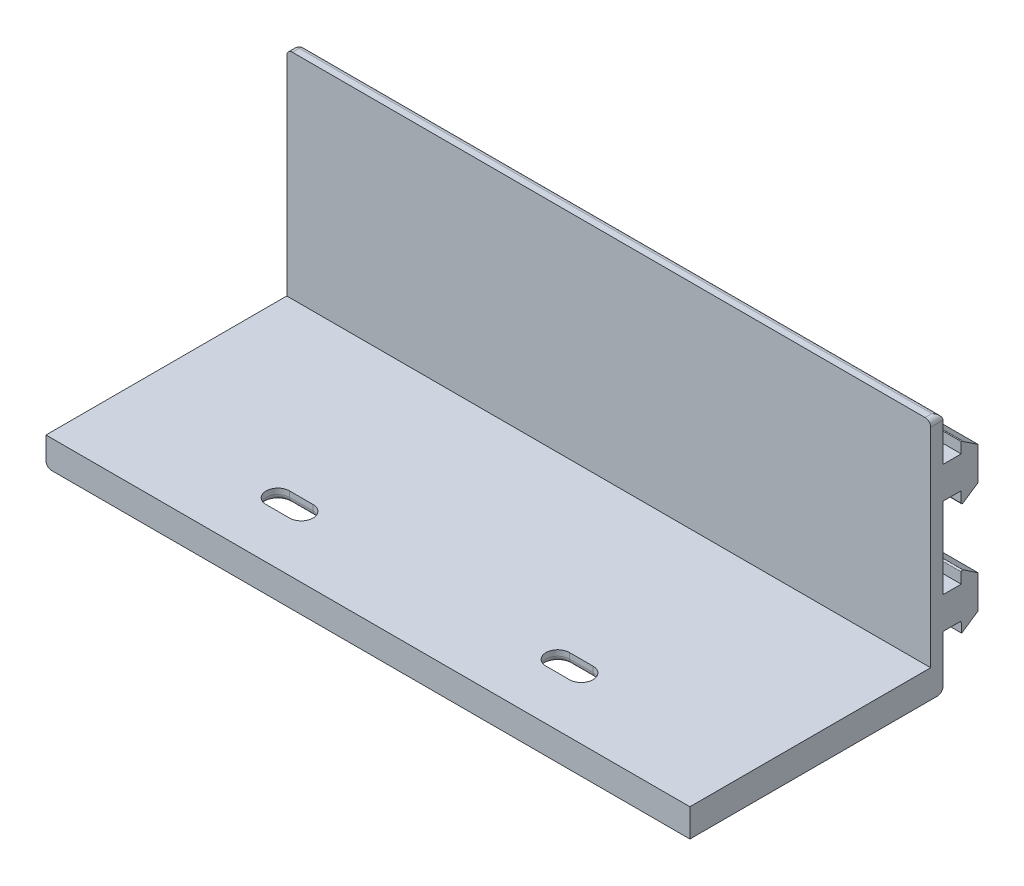
from build123d import *

# Parameters (mm, degrees)
SKETCH_1_W               = 115
SKETCH_1_H               = 30
EXTRUDE_1_DEPTH          = 29
SHELL_1_T                = -2
SKETCH_4_W               = 55
SKETCH_4_H               = 63
EXTRUDE_2_DEPTH          = 2
SKETCH_7_W               = 28
SKETCH_7_H               = 49
CUT_EXTRUDE_2_DEPTH      = 28
EXTRUDE_6_DEPTH          = 29
EXTRUDE_8_DEPTH          = 2
EXTRUDE_9_DEPTH          = 115
FILLET_1_R               = 1
SKETCH_8_R               = 1.2
CUT_EXTRUDE_5_DEPTH      = 10
SKETCH_15_W              = 113
SKETCH_15_H              = 39.979543783
CUT_EXTRUDE_6_DEPTH      = 33
CUT_EXTRUDE_7_REACH      = 152.193
SKETCH_16_W              = 16.4
SKETCH_16_H              = 9.3
SKETCH_17_W              = 40.5
SKETCH_17_H              = 2
EXTRUDE_10_DEPTH         = 113
CUT_EXTRUDE_8_DEPTH      = 147
CUT_EXTRUDE_9_DEPTH      = 147
CUT_EXTRUDE_9_DEPTH_BACK = 147
SKETCH_21_W              = 20.17617045
SKETCH_21_H              = 57.30071962
SKETCH_22_W              = 2
SKETCH_22_H              = 5
CUT_EXTRUDE_11_DEPTH     = 0.2
SKETCH_24_W              = 113
SKETCH_24_H              = 56
EXTRUDE_16_DEPTH         = 0.2
CUT_EXTRUDE_12_DEPTH     = 147
CUT_EXTRUDE_13_DEPTH     = 5
FILLET_8_R               = 1
EXTRUDE_17_DEPTH         = 3
EXTRUDE_17_DEPTH_BACK    = 1
FILLET_10_R              = 1
SKETCH_28_W              = 115
SKETCH_28_H              = 5
EXTRUDE_18_DEPTH         = 1
CUT_EXTRUDE_START        = -3
CUT_EXTRUDE_14_DEPTH     = 3
CHAMFER_7_SIZE           = 3
FILLET_11_R              = 1


with BuildPart() as part:
    # Эскиз1 → Бобышка-Вытянуть1 (new body)
    with BuildSketch(Plane(origin=(0, 0, 0), x_dir=(1, 0, 0), z_dir=(0, 1, 0))):
        with Locations((57.5, 15)):
            Rectangle(SKETCH_1_W, SKETCH_1_H)
    extrude(amount=EXTRUDE_1_DEPTH)

    # Оболочка1
    shell_1_openings = [part.faces().sort_by_distance(p)[0] for p in [
        (57.5, 14.5, 0),
    ]]
    offset(amount=SHELL_1_T, openings=shell_1_openings, kind=Kind.INTERSECTION)

    # Эскиз4 → Бобышка-Вытянуть2 (add)
    with BuildSketch(Plane(origin=(115, 0, 0), x_dir=(0, 0, -1), z_dir=(1, 0, 0))):
        with Locations((15, 31.5)):
            Rectangle(SKETCH_4_W, SKETCH_4_H)
    extrude(amount=EXTRUDE_2_DEPTH)

    # Эскиз7 → Вырез-Вытянуть2 (cut)
    with BuildSketch(Plane(origin=(117, 0, 0), x_dir=(0, 0, -1), z_dir=(1, 0, 0))):
        with Locations((14, 31.5)):
            Rectangle(SKETCH_7_W, SKETCH_7_H)
    extrude(amount=-CUT_EXTRUDE_2_DEPTH, mode=Mode.SUBTRACT)

    # Эскиз10 → Бобышка-Вытянуть6 (add)
    with BuildSketch(Plane(origin=(0, 29, 0), x_dir=(1, 0, 0), z_dir=(0, 1, 0))):
        Polygon((115, 30), (115, 28), (89, 28), (2, 28), (2, 0), (0, 0), (0, 28), (0, 30), (87, 30), align=None)
    extrude(amount=EXTRUDE_6_DEPTH)

    # Эскиз13 → Бобышка-Вытянуть8 (add)
    with BuildSketch(Plane.XZ):
        Polygon((115, 12.5), (115, 40), (0, 40), (0, 0), (115, 0), align=None)
        with BuildLine():
            ThreePointArc((34.6, 31.75), (36.7, 33.85), (34.6, 35.95))
            Line((34.6, 35.95), (30.4, 35.95))
            ThreePointArc((30.4, 35.95), (28.3, 33.85), (30.4, 31.75))
            Line((30.4, 31.75), (34.6, 31.75))
        make_face(mode=Mode.SUBTRACT)
        with BuildLine():
            ThreePointArc((80.4, 35.95), (78.3, 33.85), (80.4, 31.75))
            Line((80.4, 31.75), (84.6, 31.75))
            ThreePointArc((84.6, 31.75), (86.7, 33.85), (84.6, 35.95))
            Line((84.6, 35.95), (80.4, 35.95))
        make_face(mode=Mode.SUBTRACT)
    extrude(amount=-EXTRUDE_8_DEPTH)

    # Эскиз14 → Бобышка-Вытянуть9 (add)
    with BuildSketch(Plane.ZY):
        with BuildLine():
            Line((-33.254799468, 26.65), (-33.254799468, 24.75))
            ThreePointArc((-33.254799468, 24.75), (-33.360427883, 24.57366508), (-33.565739508, 24.583589941))
            Line((-33.565739508, 24.583589941), (-36.254799468, 26.376296582))
            Line((-36.254799468, 26.376296582), (-36.254799468, 32.326296582))
            Line((-36.254799468, 32.326296582), (-33.565739508, 34.119003222))
            ThreePointArc((-33.565739508, 34.119003222), (-33.446213245, 34.269819382), (-33.254799468, 34.25))
            Line((-33.254799468, 34.25), (-33.254799468, 32.35))
            Line((-33.254799468, 32.35), (-30, 32.35))
            Line((-30, 32.35), (-30, 26.65))
            Line((-30, 26.65), (-33.254799468, 26.65))
        make_face()
        with BuildLine():
            Line((-33.254741117, 6.5), (-33.302994959, 4.600612844))
            ThreePointArc((-33.302994959, 4.600612844), (-33.462823881, 4.6084601), (-33.565739508, 4.730996778))
            Line((-33.565739508, 4.730996778), (-36.254799468, 6.523703418))
            Line((-36.254799468, 6.523703418), (-36.254799468, 12.473703418))
            Line((-36.254799468, 12.473703418), (-33.565739508, 14.266410059))
            ThreePointArc((-33.565739508, 14.266410059), (-33.360427883, 14.27633492), (-33.254799468, 14.1))
            Line((-33.254799468, 14.1), (-33.254799468, 12.2))
            Line((-33.254799468, 12.2), (-30, 12.2))
            Line((-30, 12.2), (-30, 6.5))
            Line((-30, 6.5), (-33.254741117, 6.5))
        make_face()
    extrude(amount=-EXTRUDE_9_DEPTH)

    # Скругление1
    fillet_1_edges = [part.edges().sort_by_distance(p)[0] for p in [
        (32.5, 0, 35.95),
        (82.5, 0, 35.95),
        (82.5, 0, 31.75),
        (78.3, 0, 33.85),
        (86.7, 0, 33.85),
        (36.7, 0, 33.85),
        (28.3, 0, 33.85),
        (32.5, 0, 31.75),
    ]]
    fillet(fillet_1_edges, radius=FILLET_1_R)

    # Эскиз8 → Вырез-Вытянуть5 (cut)
    with BuildSketch(Plane(origin=(117, 0, 0), x_dir=(0, 0, -1), z_dir=(1, 0, 0))):
        with Locations((-5.5, 31.5)):
            Circle(SKETCH_8_R)
    extrude(amount=-CUT_EXTRUDE_5_DEPTH, mode=Mode.SUBTRACT)

    # Эскиз15 → Вырез-Вытянуть6 (cut)
    with BuildSketch(Plane.XY.offset(-28)):
        with Locations((58.5, 46.989771892)):
            Rectangle(SKETCH_15_W, SKETCH_15_H)
    extrude(amount=CUT_EXTRUDE_6_DEPTH, mode=Mode.SUBTRACT)

    # Эскиз16 → Вырез-Вытянуть7 (cut, up to next)
    with BuildSketch(Plane(origin=(0, 0, -30), x_dir=(-1, 0, 0), z_dir=(0, 0, -1)), mode=Mode.PRIVATE) as cut_extrude_7_sk1:
        with Locations((-53.2, 49.65)):
            Rectangle(SKETCH_16_W, SKETCH_16_H)
    cut_extrude_7_tool1 = extrude(cut_extrude_7_sk1.sketch, amount=-CUT_EXTRUDE_7_REACH, mode=Mode.PRIVATE) & part.part
    add(cut_extrude_7_tool1.solids().sort_by_distance((53.2, 49.65, -30))[0], mode=Mode.SUBTRACT)

    # Эскиз17 → Бобышка-Вытянуть10 (add)
    with BuildSketch(Plane.ZY.offset(-115)):
        with Locations((-7.75, 57)):
            Rectangle(SKETCH_17_W, SKETCH_17_H)
    extrude(amount=EXTRUDE_10_DEPTH)

    # Эскиз20 → Вырез-Вытянуть8 (cut)
    with BuildSketch(Plane.ZY):
        Polygon((0, 2), (-27.8, 2), (-27.8, 71.965307459), (29.159484087, 71.965307459), (29.159484087, 2), align=None)
    extrude(amount=-CUT_EXTRUDE_8_DEPTH, mode=Mode.SUBTRACT)

    # Эскиз21 → Вырез-Вытянуть9 (cut, two sides: drawn at the far end of the back side and taken through both)
    with BuildSketch(Plane(origin=(0, 2, 0), x_dir=(1, 0, 0), z_dir=(0, 1, 0)).offset(-CUT_EXTRUDE_9_DEPTH_BACK)):
        with Locations((125.088085225, 16.15035981)):
            Rectangle(SKETCH_21_W, SKETCH_21_H)
    extrude(amount=CUT_EXTRUDE_9_DEPTH + CUT_EXTRUDE_9_DEPTH_BACK, mode=Mode.SUBTRACT)

    # Эскиз22 → Вырез-Вытянуть11 (cut)
    with BuildSketch(Plane.XY.offset(-28)):
        with Locations((114, 4.5)):
            Rectangle(SKETCH_22_W, SKETCH_22_H)
    extrude(amount=CUT_EXTRUDE_11_DEPTH, mode=Mode.SUBTRACT)

    # Эскиз24 → Бобышка-Вытянуть16 (add)
    with BuildSketch(Plane.XY.offset(-27.8)):
        with Locations((58.5, 28)):
            Rectangle(SKETCH_24_W, SKETCH_24_H)
    extrude(amount=-EXTRUDE_16_DEPTH)

    # Эскиз25 → Вырез-Вытянуть12 (cut)
    with BuildSketch(Plane(origin=(115, 0, 0), x_dir=(0, 0, -1), z_dir=(1, 0, 0))):
        Polygon((-61.35646419, 61.721146041), (45.258808631, 61.721146041), (45.258808631, 40.2), (-10.2, 40.2), (-10.2, -7.989940419), (-61.35646419, -7.989940419), (-61.35646419, 40.2), align=None)
    extrude(amount=-CUT_EXTRUDE_12_DEPTH, mode=Mode.SUBTRACT)

    # Эскиз26 → Вырез-Вытянуть13 (cut)
    with BuildSketch(Plane(origin=(0, 2, 0), x_dir=(1, 0, 0), z_dir=(0, 1, 0))):
        with BuildLine():
            Line((30.4, -2.1), (34.6, -2.1))
            ThreePointArc((34.6, -2.1), (36.7, -4.2), (34.6, -6.3))
            Line((34.6, -6.3), (30.4, -6.3))
            ThreePointArc((30.4, -6.3), (28.3, -4.2), (30.4, -2.1))
        make_face()
        with BuildLine():
            Line((80.4, -2.1), (84.6, -2.1))
            ThreePointArc((84.6, -2.1), (86.7, -4.2), (84.6, -6.3))
            Line((84.6, -6.3), (80.4, -6.3))
            ThreePointArc((80.4, -6.3), (78.3, -4.2), (80.4, -2.1))
        make_face()
    extrude(amount=-CUT_EXTRUDE_13_DEPTH, mode=Mode.SUBTRACT)

    # Скругление8
    fillet_8_edges = [part.edges().sort_by_distance(p)[0] for p in [
        (0, 3.25, -30),
        (0, 19.425, -30),
        (0, 36.275, -30),
        (0, 40.2, -28.9),
        (57.5, 40.2, -30),
        (115, 40.2, -28.9),
        (57.5, 0, 10.2),
        (57.5, 0, -30),
        (0, 0, -9.9),
    ]]
    fillet(fillet_8_edges, radius=FILLET_8_R)

    # Эскиз27 → Бобышка-Вытянуть17 (add, two sides: drawn at the far end of the back side and taken through both)
    with BuildSketch(Plane.XZ.offset(-EXTRUDE_17_DEPTH_BACK)):
        with BuildLine():
            Line((115, -30), (115, -29))
            Line((115, -29), (115, 9.2))
            Line((115, 9.2), (115, 10.2))
            Line((115, 10.2), (115, 15.2))
            Line((115, 15.2), (0, 15.2))
            Line((0, 15.2), (0, 10.2))
            Line((0, 10.2), (0, -29))
            ThreePointArc((0, -29), (0.292893219, -29.707106781), (1, -30))
            Line((1, -30), (115, -30))
        make_face()
        with BuildLine():
            Line((84.6, 6.3), (80.4, 6.3))
            ThreePointArc((80.4, 6.3), (78.3, 4.2), (80.4, 2.1))
            Line((80.4, 2.1), (84.6, 2.1))
            ThreePointArc((84.6, 2.1), (86.7, 4.2), (84.6, 6.3))
        make_face(mode=Mode.SUBTRACT)
        with BuildLine():
            Line((30.4, 2.1), (34.6, 2.1))
            ThreePointArc((34.6, 2.1), (36.7, 4.2), (34.6, 6.3))
            Line((34.6, 6.3), (30.4, 6.3))
            ThreePointArc((30.4, 6.3), (28.3, 4.2), (30.4, 2.1))
        make_face(mode=Mode.SUBTRACT)
    extrude(amount=EXTRUDE_17_DEPTH + EXTRUDE_17_DEPTH_BACK)

    # Скругление10
    fillet_10_edges = [part.edges().sort_by_distance(p)[0] for p in [
        (58, -3, -30),
        (0, -3, -6.9),
        (0.292893219, -3, -29.707106781),
    ]]
    fillet(fillet_10_edges, radius=FILLET_10_R)

    # Эскиз28 → Бобышка-Вытянуть18 (add)
    with BuildSketch(Plane(origin=(0, 1, 0), x_dir=(1, 0, 0), z_dir=(0, 1, 0))):
        with Locations((57.5, -12.7)):
            Rectangle(SKETCH_28_W, SKETCH_28_H)
    extrude(amount=EXTRUDE_18_DEPTH)

    # Эскиз29 → Вырез-Вытянуть14 (cut)
    # profile 1 of 2: a face of its own
    with BuildSketch(Plane.XZ.offset(3).offset(CUT_EXTRUDE_START)):
        with BuildLine():
            Line((30.4, 9.3), (34.6, 9.3))
            ThreePointArc((34.6, 9.3), (39.7, 4.2), (34.6, -0.9))
            Line((34.6, -0.9), (30.4, -0.9))
            ThreePointArc((30.4, -0.9), (25.3, 4.2), (30.4, 9.3))
        make_face()
        with BuildLine():
            Line((30.4, 2.1), (34.6, 2.1))
            ThreePointArc((34.6, 2.1), (36.7, 4.2), (34.6, 6.3))
            Line((34.6, 6.3), (30.4, 6.3))
            ThreePointArc((30.4, 6.3), (28.3, 4.2), (30.4, 2.1))
        make_face(mode=Mode.SUBTRACT)
    # profile 2 of 2: a face of its own
    with BuildSketch(Plane.XZ.offset(3).offset(CUT_EXTRUDE_START)):
        with BuildLine():
            Line((80.4, -0.9), (84.6, -0.9))
            ThreePointArc((84.6, -0.9), (89.7, 4.2), (84.6, 9.3))
            Line((84.6, 9.3), (80.4, 9.3))
            ThreePointArc((80.4, 9.3), (75.3, 4.2), (80.4, -0.9))
        make_face()
        with BuildLine():
            Line((80.4, 2.1), (84.6, 2.1))
            ThreePointArc((84.6, 2.1), (86.7, 4.2), (84.6, 6.3))
            Line((84.6, 6.3), (80.4, 6.3))
            ThreePointArc((80.4, 6.3), (78.3, 4.2), (80.4, 2.1))
        make_face(mode=Mode.SUBTRACT)
    extrude(amount=CUT_EXTRUDE_14_DEPTH, mode=Mode.SUBTRACT)

    # Фаска7
    chamfer_7_edges = [part.edges().sort_by_distance(p)[0] for p in [
        (82.5, -3, -0.9),
        (89.7, -3, 4.2),
        (75.3, -3, 4.2),
        (82.5, -3, 9.3),
        (32.5, -3, -0.9),
        (39.7, -3, 4.2),
        (25.3, -3, 4.2),
        (32.5, -3, 9.3),
    ]]
    chamfer(chamfer_7_edges, length=CHAMFER_7_SIZE - 0.0001)  # a hair under: the kernel refuses the full size

    # Скругление11
    fillet_11_edges = [part.edges().sort_by_distance(p)[0] for p in [
        (32.5, 0, 6.3),
        (28.3, 0, 4.2),
        (32.5, 0, 2.1),
        (36.7, 0, 4.2),
        (82.5, 0, 6.3),
        (78.3, 0, 4.2),
        (82.5, 0, 2.1),
        (86.7, 0, 4.2),
    ]]
    fillet(fillet_11_edges, radius=FILLET_11_R)


solid = part.part
